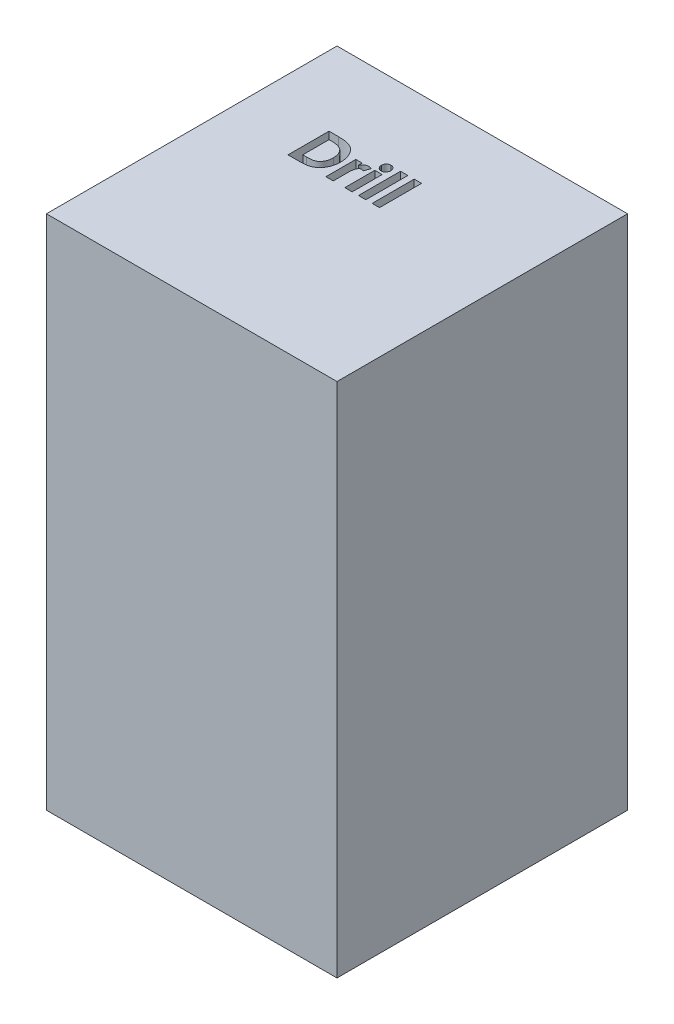
from build123d import *

# Parameters (mm, degrees)
SKETCH1_W           = 90
SKETCH1_H           = 90
BOSS_EXTRUDE1_DEPTH = 160
SKETCH2_W           = 2.27948718
SKETCH2_H           = 9.280769231
SKETCH2_W_2         = 2.279487179
SKETCH2_H_2         = 13.025641026
CUT_EXTRUDE1_DEPTH  = 150


with BuildPart() as part:
    # Sketch1 → Boss-Extrude1 (new body)
    with BuildSketch(Plane(origin=(0, 0, 0), x_dir=(1, 0, 0), z_dir=(0, 1, 0))):
        with Locations((45, 45)):
            Rectangle(SKETCH1_W, SKETCH1_H)
    extrude(amount=BOSS_EXTRUDE1_DEPTH)

    # Sketch2 → Cut-Extrude1 (cut)
    # profile 1 of 6: a face of its own
    with BuildSketch(Plane(origin=(0, 160, 0), x_dir=(1, 0, 0), z_dir=(0, 1, 0))):
        with BuildLine():
            Line((21.611077672, 65.922158503), (24.483333281, 65.922158503))
            add(Edge.make_bspline(
                [(24.483333281, 65.922158503), (24.707258642, 65.920593189), (25.140108898, 65.917567417), (25.767223285, 65.88347425), (26.350359864, 65.831041379), (26.889894536, 65.758910462), (27.384721167, 65.663461507), (27.834201687, 65.543739501), (28.239844663, 65.405540361), (28.606097885, 65.242921031), (28.940451848, 65.053323041), (29.257931608, 64.842126103), (29.557913799, 64.601593454), (29.844608198, 64.336365449), (30.114314952, 64.041589823), (30.371525645, 63.722149129), (30.609942592, 63.373411035), (30.836772622, 63.003737182), (31.0419102, 62.611560926), (31.220838862, 62.200220391), (31.370728486, 61.772362706), (31.492521568, 61.327531886), (31.589604711, 60.867204634), (31.657531829, 60.390452053), (31.69952505, 59.897715535), (31.703784912, 59.563763804), (31.705949466, 59.394073568)],
                knots=[0, 0, 0, 0, 1.44355588, 2.790409838, 4.047694926, 5.217575253, 6.298404546, 7.294384826, 8.214239204, 9.058592145, 9.873746385, 10.689560431, 11.514393297, 12.350027578, 13.205127629, 14.088021785, 14.991911688, 15.926770944, 16.882954281, 17.842803888, 18.816321264, 19.80318086, 20.814351908, 21.847355356, 22.906180909, 24, 24, 24, 24], degree=3))
            add(Edge.make_bspline(
                [(31.705949466, 59.394073568), (31.700281493, 59.154629598), (31.689123756, 58.683270128), (31.595137212, 57.991555537), (31.443129146, 57.328478111), (31.229391999, 56.699224698), (30.964415152, 56.109398894), (30.647870638, 55.569402028), (30.284399734, 55.082132531), (29.8782369, 54.650016606), (29.438461471, 54.278607111), (28.981446119, 53.960522058), (28.502738681, 53.709685452), (28.080930527, 53.550617534), (27.715170235, 53.451691051), (27.394036655, 53.393224547), (27.029261674, 53.339607236), (26.617444083, 53.298172932), (26.160390436, 53.261223715), (25.656278912, 53.241146949), (25.106741679, 53.224466136), (24.725036111, 53.22294787), (24.526582479, 53.222158503)],
                knots=[0, 0, 0, 0, 1.315458931, 2.589557908, 3.828601765, 5.048913369, 6.235739168, 7.376350998, 8.481830359, 9.569842114, 10.627874879, 11.640079404, 12.624025415, 13.590060155, 14.111227486, 14.704434459, 15.382649715, 16.137166398, 16.978595427, 17.902333227, 18.909396075, 20, 20, 20, 20], degree=3))
            Line((24.526582479, 53.222158503), (21.611077672, 53.222158503))
            Line((21.611077672, 53.222158503), (21.611077672, 65.922158503))
        make_face()
        with BuildLine():
            Line((23.890564851, 63.642671324), (23.890564851, 55.501645683))
            Line((23.890564851, 55.501645683), (25.081189851, 55.501645683))
            add(Edge.make_bspline(
                [(25.081189851, 55.501645683), (25.222855941, 55.501905274), (25.495326993, 55.502404554), (25.888713514, 55.52618568), (26.252496301, 55.550055373), (26.585673943, 55.595360849), (26.890671205, 55.645827961), (27.163298221, 55.716059857), (27.409175021, 55.789832515), (27.625298266, 55.883754252), (27.823249549, 55.989469418), (28.006529826, 56.11332699), (28.183446608, 56.250866153), (28.350692293, 56.406132129), (28.508899865, 56.577068904), (28.657133269, 56.764557241), (28.797371028, 56.968025107), (28.926013504, 57.188548286), (29.043567688, 57.423798005), (29.147851421, 57.671495526), (29.234318024, 57.933703637), (29.306183771, 58.207967754), (29.357539996, 58.496675658), (29.400027477, 58.797688929), (29.421931011, 59.112200156), (29.424937135, 59.326204107), (29.426462287, 59.434778696)],
                knots=[0, 0, 0, 0, 1.50275155, 2.890291501, 4.180787663, 5.369391935, 6.45668281, 7.458360028, 8.354766181, 9.177074746, 9.954075863, 10.732690366, 11.5210699, 12.329727389, 13.151100085, 13.990027547, 14.863562427, 15.770965086, 16.696477834, 17.652329173, 18.619756807, 19.62365428, 20.657822005, 21.729286259, 22.847956731, 24, 24, 24, 24], degree=3))
            add(Edge.make_bspline(
                [(29.426462287, 59.434778696), (29.423424701, 59.601158989), (29.417501644, 59.92558767), (29.360380967, 60.398125124), (29.267399399, 60.843089927), (29.134723662, 61.258830694), (28.967481782, 61.646515876), (28.758139585, 62.002860957), (28.515706351, 62.333852044), (28.323996765, 62.528022037), (28.228205075, 62.625043119)],
                knots=[0, 0, 0, 0, 1.13821349, 2.219428113, 3.251817212, 4.244760574, 5.201143372, 6.134805572, 7.068016741, 8, 8, 8, 8], degree=3))
            add(Edge.make_bspline(
                [(28.228205075, 62.625043119), (28.133745399, 62.707718197), (27.940822207, 62.876572683), (27.602112479, 63.078903538), (27.228871901, 63.256671027), (26.812561848, 63.39762082), (26.357205771, 63.509089926), (25.86009156, 63.585967442), (25.32388137, 63.635368119), (24.952407444, 63.640184767), (24.760636966, 63.642671324)],
                knots=[0, 0, 0, 0, 0.813307809, 1.661089106, 2.549956539, 3.493439533, 4.508053171, 5.589449661, 6.755572447, 8, 8, 8, 8], degree=3))
            Line((24.760636966, 63.642671324), (23.890564851, 63.642671324))
        make_face(mode=Mode.SUBTRACT)
    # profile 2 of 6: a face of its own
    with BuildSketch(Plane(origin=(0, 160, 0), x_dir=(1, 0, 0), z_dir=(0, 1, 0))):
        with BuildLine():
            Line((33.334154595, 62.502927734), (35.288000749, 62.502927734))
            Line((35.288000749, 62.502927734), (35.288000749, 61.360640074))
            add(Edge.make_bspline(
                [(35.288000749, 61.360640074), (35.343271305, 61.462155493), (35.451299902, 61.66057159), (35.649757493, 61.926905908), (35.877753612, 62.151205239), (36.127095654, 62.338161009), (36.398539324, 62.483874674), (36.684815845, 62.587714031), (36.983476127, 62.655195223), (37.187212046, 62.662205243), (37.290184242, 62.665748247)],
                knots=[0, 0, 0, 0, 1.09866127, 2.147379032, 3.14564304, 4.131443017, 5.102343063, 6.064490016, 7.021754664, 8, 8, 8, 8], degree=3))
            add(Edge.make_bspline(
                [(37.290184242, 62.665748247), (37.364954905, 62.662247019), (37.517214674, 62.655117269), (37.749279987, 62.613671922), (37.984693596, 62.538730853), (38.139616036, 62.471256381), (38.218769979, 62.436781901)],
                knots=[0, 0, 0, 0, 0.931404136, 1.896671404, 2.925354185, 4, 4, 4, 4], degree=3))
            Line((38.218769979, 62.436781901), (37.511518377, 60.505832382))
            add(Edge.make_bspline(
                [(37.511518377, 60.505832382), (37.448300183, 60.536376356), (37.329474315, 60.593787271), (37.156959787, 60.661538064), (37.000395699, 60.702876287), (36.901136942, 60.709044312), (36.855148184, 60.711902093)],
                knots=[0, 0, 0, 0, 1.214386998, 2.282580073, 3.20428172, 4, 4, 4, 4], degree=3))
            add(Edge.make_bspline(
                [(36.855148184, 60.711902093), (36.811725854, 60.710008376), (36.726306649, 60.706283109), (36.600230293, 60.674358835), (36.481492619, 60.619306412), (36.364371666, 60.548778795), (36.258106978, 60.450740133), (36.151907928, 60.337242974), (36.058319638, 60.197115636), (35.959556851, 60.041146791), (35.875463869, 59.850241066), (35.803356726, 59.622338971), (35.739108683, 59.354803523), (35.694897257, 59.046214239), (35.65216514, 58.699557253), (35.626729934, 58.312288146), (35.607772753, 57.8856315), (35.606613649, 57.587809763), (35.606009563, 57.432595202)],
                knots=[0, 0, 0, 0, 0.544232178, 1.070598461, 1.618251235, 2.182094276, 2.777567932, 3.425210017, 4.127676488, 4.886675562, 5.738955394, 6.734782583, 7.883056018, 9.186093582, 10.642914445, 12.264202625, 14.053029461, 16, 16, 16, 16], degree=3))
            Line((35.606009563, 57.432595202), (35.613641774, 56.979750651))
            Line((35.613641774, 56.979750651), (35.613641774, 53.222158503))
            Line((35.613641774, 53.222158503), (33.334154595, 53.222158503))
            Line((33.334154595, 53.222158503), (33.334154595, 62.502927734))
        make_face()
    # profile 3 of 6: a face of its own
    with BuildSketch(Plane(origin=(0, 160, 0), x_dir=(1, 0, 0), z_dir=(0, 1, 0))):
        with BuildLine():
            add(Edge.make_bspline(
                [(40.330348505, 66.410620042), (40.428594386, 66.405799727), (40.62150964, 66.396334575), (40.897886993, 66.304070393), (41.151545391, 66.159264517), (41.375786449, 65.960587403), (41.562289193, 65.723330591), (41.704784215, 65.457705815), (41.784162256, 65.163402119), (41.795186692, 64.960100203), (41.800821261, 64.856192959)],
                knots=[0, 0, 0, 0, 0.989868614, 1.943702388, 2.910836514, 3.924849579, 4.949916355, 5.946401046, 6.950409252, 8, 8, 8, 8], degree=3))
            add(Edge.make_bspline(
                [(41.800821261, 64.856192959), (41.795388287, 64.753051453), (41.784801879, 64.552075317), (41.702957281, 64.261766931), (41.566181513, 63.996271169), (41.378168214, 63.762538061), (41.156358222, 63.56706076), (40.908242454, 63.41962602), (40.634513598, 63.332494474), (40.444591807, 63.322238088), (40.348156999, 63.317030298)],
                knots=[0, 0, 0, 0, 1.05296456, 2.051751585, 3.055639087, 4.085634717, 5.099016424, 6.062201612, 7.016062274, 8, 8, 8, 8], degree=3))
            add(Edge.make_bspline(
                [(40.348156999, 63.317030298), (40.249053512, 63.321833381), (40.054459903, 63.331264425), (39.775815687, 63.423744483), (39.518774135, 63.567409919), (39.295505833, 63.770146314), (39.106867216, 64.009089016), (38.970596432, 64.280897766), (38.885355686, 64.577213904), (38.875237684, 64.783526859), (38.870052031, 64.889265875)],
                knots=[0, 0, 0, 0, 0.989065327, 1.942068821, 2.907541208, 3.917690034, 4.939857478, 5.938239964, 6.943311734, 8, 8, 8, 8], degree=3))
            add(Edge.make_bspline(
                [(38.870052031, 64.889265875), (38.87569544, 64.990655977), (38.886781102, 65.189822194), (38.966634626, 65.477582657), (39.105862243, 65.738741864), (39.291021589, 65.971655469), (39.513293056, 66.166626507), (39.766799179, 66.307034534), (40.041316502, 66.395487942), (40.233009707, 66.405523927), (40.330348505, 66.410620042)],
                knots=[0, 0, 0, 0, 1.038616768, 2.040212704, 3.031499824, 4.052181184, 5.074969369, 6.039807101, 7.004644834, 8, 8, 8, 8], degree=3))
        make_face()
    # profile 4 of 6: a face of its own
    with BuildSketch(Plane(origin=(0, 160, 0), x_dir=(1, 0, 0), z_dir=(0, 1, 0))):
        with Locations((40.335436646, 57.862543118)):
            Rectangle(SKETCH2_W, SKETCH2_H)
    # profile 5 of 6: a face of its own
    with BuildSketch(Plane(origin=(0, 160, 0), x_dir=(1, 0, 0), z_dir=(0, 1, 0))):
        with Locations((44.56876998, 59.734979016)):
            Rectangle(SKETCH2_W_2, SKETCH2_H_2)
    # profile 6 of 6: a face of its own
    with BuildSketch(Plane(origin=(0, 160, 0), x_dir=(1, 0, 0), z_dir=(0, 1, 0))):
        with Locations((48.802103313, 59.734979016)):
            Rectangle(SKETCH2_W_2, SKETCH2_H_2)
    extrude(amount=-CUT_EXTRUDE1_DEPTH, mode=Mode.SUBTRACT)


solid = part.part
